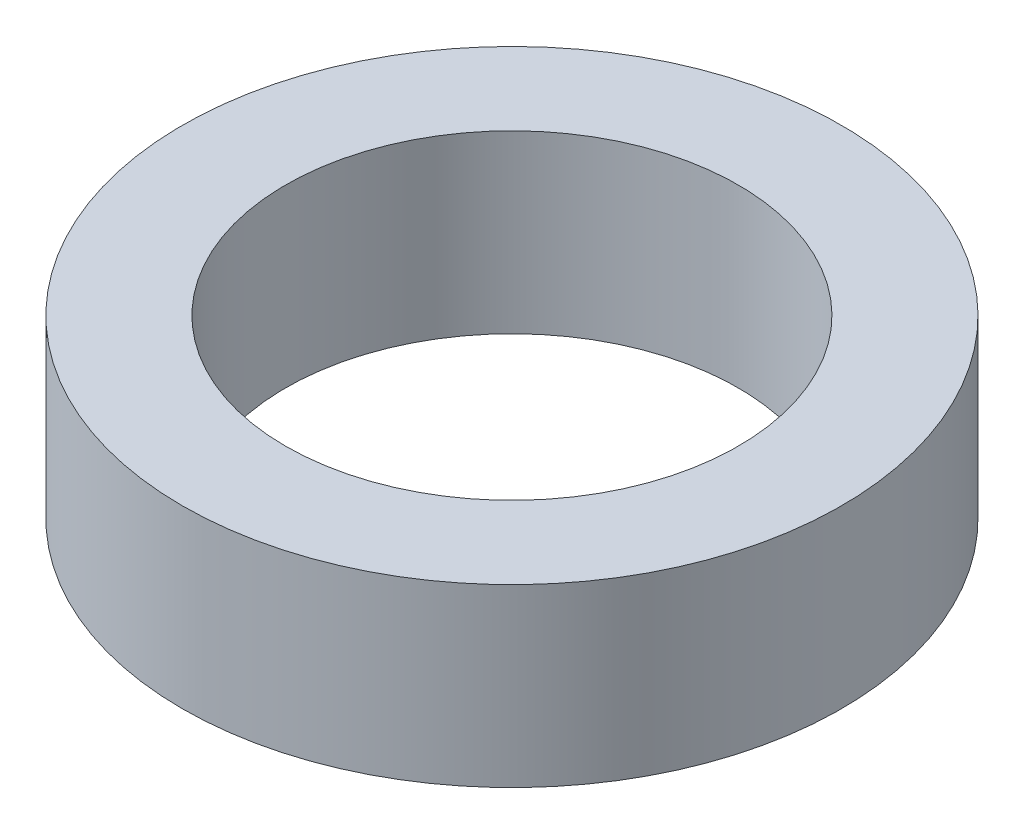
from build123d import *

# Parameters (mm, degrees)
SKETCH1_R           = 7.5
BOSS_EXTRUDE1_DEPTH = 4
SKETCH2_R           = 5.15
CUT_EXTRUDE1_DEPTH  = 4


with BuildPart() as part:
    # Sketch1 → Boss-Extrude1 (new body)
    with BuildSketch(Plane(origin=(0, 0, 0), x_dir=(1, 0, 0), z_dir=(0, 1, 0))):
        Circle(SKETCH1_R)
    extrude(amount=BOSS_EXTRUDE1_DEPTH)

    # Sketch2 → Cut-Extrude1 (cut)
    with BuildSketch(Plane(origin=(0, 4, 0), x_dir=(1, 0, 0), z_dir=(0, 1, 0))):
        Circle(SKETCH2_R)
    extrude(amount=-CUT_EXTRUDE1_DEPTH, mode=Mode.SUBTRACT)


solid = part.part
